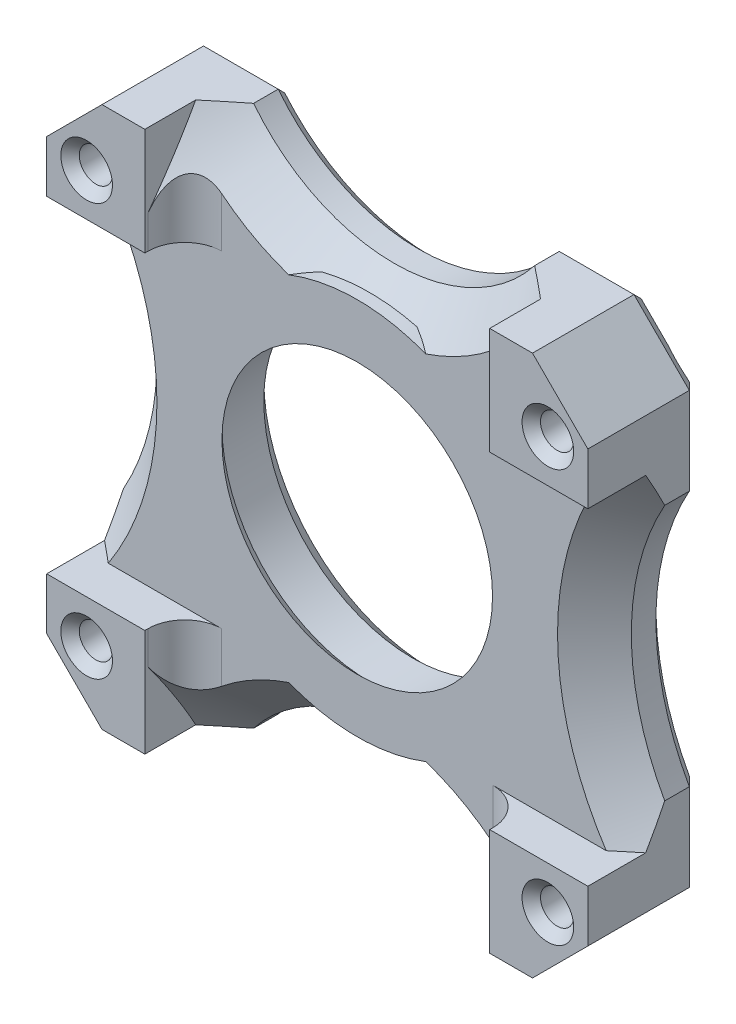
from build123d import *

# Parameters (mm, degrees)
CROQUIS1_W              = 44
CROQUIS1_H              = 44
CROQUIS1_R              = 12.1
SALIENTE_EXTRUIR1_DEPTH = 6
CHAFL_N2_SIZE           = 4.5
CROQUIS2_R              = 1.35
CORTAR_EXTRUIR1_DEPTH   = 32.685959036
CROQUIS3_R              = 21.308128052
CORTAR_EXTRUIR2_DEPTH   = 32.685959036
CHAFL_N4_SIZE           = 1
SALIENTE_EXTRUIR2_START = 3.25
CROQUIS4_R              = 1.35
SALIENTE_EXTRUIR2_DEPTH = 3.25
CHAFL_N5_SIZE           = 3
CHAFL_N3_SIZE           = 0.75
REDONDEO1_R             = 3
CROQUIS5_R              = 15.396724601
CROQUIS5_R_2            = 11
SALIENTE_EXTRUIR4_DEPTH = 1
CHAFL_N6_SIZE           = 1.5
CHAFL_N7_SIZE           = 1


# Some blends are built 0.0001 mm under size
with BuildPart() as part:
    # Croquis1 → Saliente-Extruir1 (new body)
    with BuildSketch(Plane.XY):
        Rectangle(CROQUIS1_W, CROQUIS1_H)
        Circle(CROQUIS1_R, mode=Mode.SUBTRACT)
    extrude(amount=SALIENTE_EXTRUIR1_DEPTH)

    # Chaflán2
    chafl_n2_edges = [part.edges().sort_by_distance(p)[0] for p in [
        (-22, 22, 3),
        (22, 22, 3),
        (22, -22, 3),
        (-22, -22, 3),
    ]]
    chamfer(chafl_n2_edges, length=CHAFL_N2_SIZE)

    # Croquis2 → Cortar-Extruir1 (cut, through all)
    with BuildSketch(Plane.XY.offset(6)):
        with Locations((-18.75, -16.75)):
            Circle(CROQUIS2_R)
        with Locations((18.75, -16.75)):
            Circle(CROQUIS2_R)
        with Locations((18.75, 16.75)):
            Circle(CROQUIS2_R)
        with Locations((-18.75, 16.75)):
            Circle(CROQUIS2_R)
    extrude(amount=-CORTAR_EXTRUIR1_DEPTH, mode=Mode.SUBTRACT)

    # Croquis3 → Cortar-Extruir2 (cut, through all)
    with BuildSketch(Plane.XY.offset(6)):
        with Locations((40.594273769, 0)):
            Circle(CROQUIS3_R)
        with Locations((-40.594273769, 0)):
            Circle(CROQUIS3_R)
        with BuildLine():
            Line((14.527768994, 48.750256971), (14.527768994, 30.973585325))
            ThreePointArc((14.527768994, 30.973585325), (0, 16.445816331), (-14.527768994, 30.973585325))
            Line((-14.527768994, 30.973585325), (-14.527768994, 48.750256971))
            ThreePointArc((-14.527768994, 48.750256971), (0, 63.278025965), (14.527768994, 48.750256971))
        make_face()
        with BuildLine():
            Line((14.527768994, -48.750256971), (14.527768994, -30.973585325))
            ThreePointArc((14.527768994, -30.973585325), (0, -16.445816331), (-14.527768994, -30.973585325))
            Line((-14.527768994, -30.973585325), (-14.527768994, -48.750256971))
            ThreePointArc((-14.527768994, -48.750256971), (0, -63.278025965), (14.527768994, -48.750256971))
        make_face()
    extrude(amount=-CORTAR_EXTRUIR2_DEPTH, mode=Mode.SUBTRACT)

    # Chaflán4
    chafl_n4_edges = [part.edges().sort_by_distance(p)[0] for p in [
        (-22, 13.953107343, 0),
        (14.462504669, 22, 0),
        (22, -13.953107343, 0),
        (-14.462504669, -22, 0),
        (19.75, -19.75, 0),
        (-19.75, -19.75, 0),
        (19.75, 19.75, 0),
        (-19.75, 19.75, 0),
        (-14.462504669, 22, 0),
        (22, 13.953107343, 0),
        (14.462504669, -22, 0),
        (-22, -13.953107343, 0),
        (19.286145717, 0, 0),
        (0, -16.445816331, 0),
        (0, 16.445816331, 0),
        (-19.286145717, 0, 0),
    ]]
    chamfer(chafl_n4_edges, length=CHAFL_N4_SIZE)

    # Croquis4 → Saliente-Extruir2 (add)
    # profile 1 of 4: a face of its own
    with BuildSketch(Plane.XY.offset(6).offset(SALIENTE_EXTRUIR2_START)):
        Polygon((-22, -17.5), (-17.5, -22), (-14.019564426, -22), (-14.019564426, -13.289292173), (-22, -13.289292173), align=None)
        with Locations((-18.75, -16.75)):
            Circle(CROQUIS4_R, mode=Mode.SUBTRACT)
    # profile 2 of 4: a face of its own
    with BuildSketch(Plane.XY.offset(6).offset(SALIENTE_EXTRUIR2_START)):
        Polygon((22, -13.289292173), (22, -17.5), (17.5, -22), (14.019564426, -22), (14.019564426, -13.289292173), align=None)
        with Locations((18.75, -16.75)):
            Circle(CROQUIS4_R, mode=Mode.SUBTRACT)
    # profile 3 of 4: a face of its own
    with BuildSketch(Plane.XY.offset(6).offset(SALIENTE_EXTRUIR2_START)):
        Polygon((22, 17.5), (17.5, 22), (14.019564426, 22), (14.019564426, 13.289292173), (22, 13.289292173), align=None)
        with Locations((18.75, 16.75)):
            Circle(CROQUIS4_R, mode=Mode.SUBTRACT)
    # profile 4 of 4: a face of its own
    with BuildSketch(Plane.XY.offset(6).offset(SALIENTE_EXTRUIR2_START)):
        Polygon((-22, 13.289292173), (-22, 17.5), (-17.5, 22), (-14.019564426, 22), (-14.019564426, 13.289292173), align=None)
        with Locations((-18.75, 16.75)):
            Circle(CROQUIS4_R, mode=Mode.SUBTRACT)
    extrude(amount=-SALIENTE_EXTRUIR2_DEPTH)

    # Chaflán5
    chafl_n5_edges = [part.edges().sort_by_distance(p)[0] for p in [
        (-19.286145717, 0, 6),
        (19.286145717, 0, 6),
        (0, -16.445816331, 6),
        (0, 16.445816331, 6),
    ]]
    chamfer(chafl_n5_edges, length=CHAFL_N5_SIZE)

    # Chaflán3
    # the kernel refuses this chamfer: 0.75 mm, written as the material it takes off along each edge
    with BuildSketch(Plane(origin=(-18.75, -16.75, 9.25), x_dir=(1, 0, 0), z_dir=(0, -1, 0))) as chafl_n3_piece_1:
        Polygon((1.35, -CHAFL_N3_SIZE), (1.35 + CHAFL_N3_SIZE, 0), (1.35, 0), align=None)
    revolve(axis=Axis((-18.75, -16.75, 9.25), (0, 0, 1)), mode=Mode.SUBTRACT)
    with BuildSketch(Plane(origin=(18.75, -16.75, 9.25), x_dir=(1, 0, 0), z_dir=(0, -1, 0))) as chafl_n3_piece_2:
        Polygon((1.35, -CHAFL_N3_SIZE), (1.35 + CHAFL_N3_SIZE, 0), (1.35, 0), align=None)
    revolve(axis=Axis((18.75, -16.75, 9.25), (0, 0, 1)), mode=Mode.SUBTRACT)
    with BuildSketch(Plane(origin=(18.75, 16.75, 9.25), x_dir=(1, 0, 0), z_dir=(0, -1, 0))) as chafl_n3_piece_3:
        Polygon((1.35 + CHAFL_N3_SIZE, 0), (1.35, -CHAFL_N3_SIZE), (1.35, 0), align=None)
    revolve(axis=Axis((18.75, 16.75, 9.25), (0, 0, 1)), mode=Mode.SUBTRACT)
    with BuildSketch(Plane(origin=(-18.75, 16.75, 9.25), x_dir=(1, 0, 0), z_dir=(0, -1, 0))) as chafl_n3_piece_4:
        Polygon((1.35 + CHAFL_N3_SIZE, 0), (1.35, -CHAFL_N3_SIZE), (1.35, 0), align=None)
    revolve(axis=Axis((-18.75, 16.75, 9.25), (0, 0, 1)), mode=Mode.SUBTRACT)
    with BuildSketch(Plane(origin=(-18.75, 16.75, 0), x_dir=(1, 0, 0), z_dir=(0, -1, 0))) as chafl_n3_piece_5:
        Polygon((1.35 + CHAFL_N3_SIZE, 0), (1.35, CHAFL_N3_SIZE), (1.35, 0), align=None)
    revolve(axis=Axis((-18.75, 16.75, 0), (0, 0, 1)), mode=Mode.SUBTRACT)
    with BuildSketch(Plane(origin=(18.75, 16.75, 0), x_dir=(1, 0, 0), z_dir=(0, -1, 0))) as chafl_n3_piece_6:
        Polygon((1.35 + CHAFL_N3_SIZE, 0), (1.35, CHAFL_N3_SIZE), (1.35, 0), align=None)
    revolve(axis=Axis((18.75, 16.75, 0), (0, 0, 1)), mode=Mode.SUBTRACT)
    with BuildSketch(Plane(origin=(18.75, -16.75, 0), x_dir=(1, 0, 0), z_dir=(0, -1, 0))) as chafl_n3_piece_7:
        Polygon((1.35 + CHAFL_N3_SIZE, 0), (1.35, CHAFL_N3_SIZE), (1.35, 0), align=None)
    revolve(axis=Axis((18.75, -16.75, 0), (0, 0, 1)), mode=Mode.SUBTRACT)
    with BuildSketch(Plane(origin=(-18.75, -16.75, 0), x_dir=(1, 0, 0), z_dir=(0, -1, 0))) as chafl_n3_piece_8:
        Polygon((1.35 + CHAFL_N3_SIZE, 0), (1.35, CHAFL_N3_SIZE), (1.35, 0), align=None)
    revolve(axis=Axis((-18.75, -16.75, 0), (0, 0, 1)), mode=Mode.SUBTRACT)

    # Redondeo1
    redondeo1_edges = [part.edges().sort_by_distance(p)[0] for p in [
        (14.019564426, -16.871341335, 6),
        (-14.019564426, 16.871341335, 6),
        (-14.019564426, -16.871341335, 6),
        (14.019564426, 16.871341335, 6),
    ]]
    fillet(redondeo1_edges, radius=REDONDEO1_R)

    # Croquis5 → Saliente-Extruir4 (add)
    with BuildSketch(Plane(origin=(0, 0, 6), x_dir=(-1, 0, 0), z_dir=(0, 0, -1))):
        Circle(CROQUIS5_R)
        Circle(CROQUIS5_R_2, mode=Mode.SUBTRACT)
    extrude(amount=SALIENTE_EXTRUIR4_DEPTH)

    # Chaflán6
    chafl_n6_edges = [part.edges().sort_by_distance(p)[0] for p in [
        (-12.1, 0, 0),
    ]]
    chamfer(chafl_n6_edges, length=CHAFL_N6_SIZE)

    # Chaflán7
    chafl_n7_edges = [part.edges().sort_by_distance(p)[0] for p in [
        (11, 0, 5),
    ]]
    chamfer(chafl_n7_edges, length=CHAFL_N7_SIZE - 0.0001)  # a hair under: the kernel refuses the full size


solid = part.part
